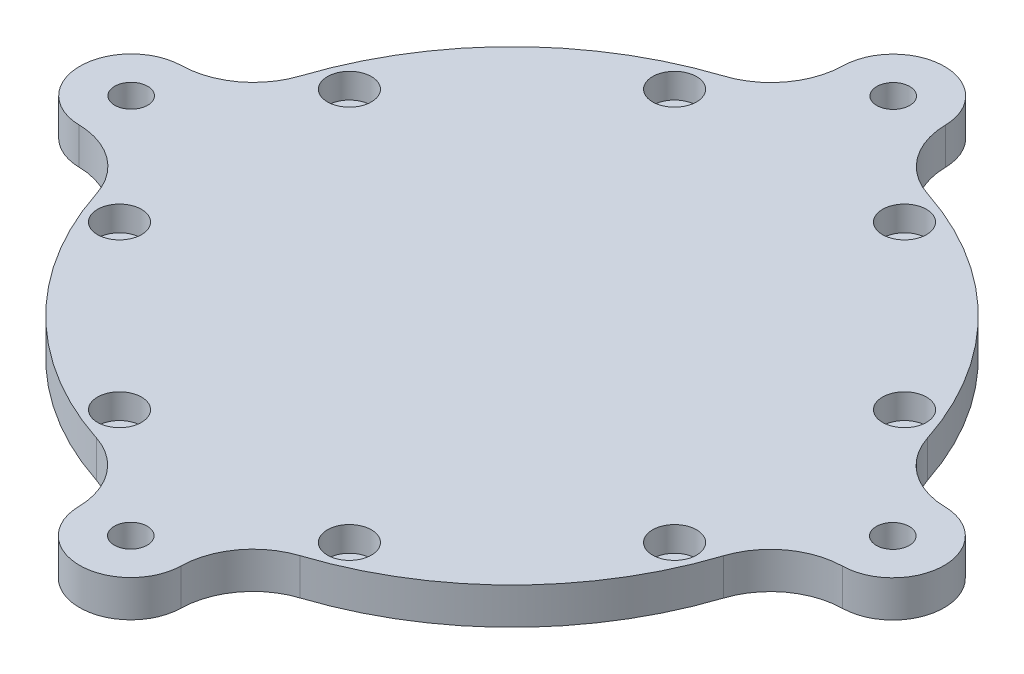
from build123d import *

# Parameters (mm, degrees)
SKETCH1_R                                           = 45
SKETCH1_R_2                                         = 1.5
BOSS_EXTRUDE2_DEPTH                                 = 5
SKETCH9_R                                           = 3.937
BOSS_EXTRUDE7_DEPTH                                 = 4
BOSS_EXTRUDE8_DEPTH                                 = 5
FILLET1_R                                           = 10
SKETCH17_R                                          = 8.317724374
BOSS_EXTRUDE9_DEPTH                                 = 10
CIRPATTERN1_COUNT                                   = 4
FILLET1_OF_CIRPATTERN1_R                            = 10
CUT_EXTRUDE10_DEPTH                                 = 80.287191874
CUT_EXTRUDE10_DEPTH_BACK                            = 80.287191874
SKETCH18_W                                          = 16.635448748
SKETCH18_H                                          = 10
SKETCH18_W_2                                        = 61.874
SKETCH18_H_2                                        = 4
M3_TAPPED_HOLE1_D                                   = 2.5
M3_TAPPED_HOLE1_DEPTH                               = 3.248924226
M3_TAPPED_HOLE1_TIP                                 = 0.751075774
BODY_MOVE_COPY1_OUTLINE_R                           = 2.25
BODY_MOVE_COPY1_OUTLINE_R_2                         = 1.5
BODY_MOVE_COPY1_OUTLINE_R_3                         = 1.25
BODY_MOVE_COPY1_DEPTH                               = 5
BODY_MOVE_COPY1_6_OUTLINE_R                         = 1.5
BODY_MOVE_COPY1_6_OUTLINE_R_2                       = 2.25
BODY_MOVE_COPY1_6_DEPTH                             = 5
BODY_MOVE_COPY1_7_OUTLINE_R                         = 1.25
BODY_MOVE_COPY1_7_DEPTH                             = 0.5281
CBORE_FOR_M3_HEX_SOCKET_HEAD_CAP_SCREW6_D           = 3.4
CBORE_FOR_M3_HEX_SOCKET_HEAD_CAP_SCREW6_CBORE_D     = 6
CBORE_FOR_M3_HEX_SOCKET_HEAD_CAP_SCREW6_CBORE_DEPTH = 3.4


# Read off the part's stored shape, not the designer's step: Body-Move/Copy1
with BuildPart() as part:
    # Sketch1 → Boss-Extrude2 (new body)
    with BuildSketch(Plane(origin=(0, 0, 0), x_dir=(1, 0, 0), z_dir=(0, 1, 0))):
        with Locations(Location((0, 0, 0), (0, 0, 270))):
            Circle(SKETCH1_R)
        with Locations(Location((0, 41, 0), (0, 0, 270))):
            Circle(SKETCH1_R_2, mode=Mode.SUBTRACT)
        with Locations(Location((28.991378029, 28.991378029, 0), (0, 0, 270))):
            Circle(SKETCH1_R_2, mode=Mode.SUBTRACT)
        with Locations(Location((41, 0, 0), (0, 0, 270))):
            Circle(SKETCH1_R_2, mode=Mode.SUBTRACT)
        with Locations(Location((28.991378029, -28.991378029, 0), (0, 0, 270))):
            Circle(SKETCH1_R_2, mode=Mode.SUBTRACT)
        with Locations(Location((0, -41, 0), (0, 0, 270))):
            Circle(SKETCH1_R_2, mode=Mode.SUBTRACT)
        with Locations(Location((-28.991378029, -28.991378029, 0), (0, 0, 270))):
            Circle(SKETCH1_R_2, mode=Mode.SUBTRACT)
        with Locations(Location((-41, 0, 0), (0, 0, 270))):
            Circle(SKETCH1_R_2, mode=Mode.SUBTRACT)
        with Locations(Location((-28.991378029, 28.991378029, 0), (0, 0, 270))):
            Circle(SKETCH1_R_2, mode=Mode.SUBTRACT)
    extrude(amount=BOSS_EXTRUDE2_DEPTH)

    # Sketch9 → Boss-Extrude7 (add)
    with BuildSketch(Plane.XZ):
        with Locations(Location((27, 0, 0), (0, 0, 90))):
            Circle(SKETCH9_R)
        with Locations(Location((0, -27, 0), (0, 0, 90))):
            Circle(SKETCH9_R)
        with Locations(Location((-27, 0, 0), (0, 0, 90))):
            Circle(SKETCH9_R)
        with Locations(Location((0, 27, 0), (0, 0, 90))):
            Circle(SKETCH9_R)
    extrude(amount=BOSS_EXTRUDE7_DEPTH)

    # Sketch16 → Boss-Extrude8 (add)
    with BuildSketch(Plane.XZ):
        with BuildLine():
            ThreePointArc((45.376634658, -26.343140039), (41.586295626, -22.556734731), (41.583514038, -17.199167429))
            ThreePointArc((41.583514038, -17.199167429), (40.114970744, -20.390907832), (38.401897955, -23.458351039))
            Line((38.401897955, -23.458351039), (45.376634658, -26.343140039))
        make_face()
        with BuildLine():
            Line((50.727486729, -13.406046775), (43.752750026, -10.521257775))
            ThreePointArc((43.752750026, -10.521257775), (42.798576033, -13.902585715), (41.583514038, -17.199167429))
            ThreePointArc((41.583514038, -17.199167429), (45.36991937, -13.408828339), (50.727486729, -13.406046775))
        make_face()
        with BuildLine():
            Line((45.972884991, -19.014635038), (41.583514062, -17.199167371))
            ThreePointArc((41.583514062, -17.199167371), (41.586295614, -22.556734702), (45.376634658, -26.343140039))
            Line((45.376634658, -26.343140039), (47.192102325, -21.95376911))
            ThreePointArc((47.192102325, -21.95376911), (45.973779061, -20.736710252), (45.972884991, -19.014635038))
        make_face()
        with BuildLine():
            ThreePointArc((50.727486729, -13.406046775), (45.369919398, -13.408828327), (41.583514062, -17.199167371))
            Line((41.583514062, -17.199167371), (45.972884991, -19.014635038))
            ThreePointArc((45.972884991, -19.014635038), (47.189943849, -17.796311774), (48.912019062, -17.795417704))
            Line((48.912019062, -17.795417704), (50.727486729, -13.406046775))
        make_face()
        with BuildLine():
            ThreePointArc((55.052060694, -19.874593407), (53.871338237, -15.984091013), (50.727486729, -13.406046775))
            Line((50.727486729, -13.406046775), (48.912019062, -17.795417704))
            ThreePointArc((48.912019062, -17.795417704), (49.922542761, -18.62407478), (50.302060694, -19.874593407))
            ThreePointArc((50.302060694, -19.874593407), (49.30257932, -21.745075474), (47.192102325, -21.95376911))
            Line((47.192102325, -21.95376911), (45.376634658, -26.343140039))
            ThreePointArc((45.376634658, -26.343140039), (51.942563088, -25.69387095), (55.052060694, -19.874593407))
        make_face()
    boss_extrude8 = extrude(amount=-BOSS_EXTRUDE8_DEPTH)

    # Fillet1
    fillet1_edges = [part.edges().sort_by_distance(p)[0] for p in [
        (43.752750026, 2.5, -10.521257775),
        (38.401897955, 2.5, -23.458351039),
    ]]
    fillet(fillet1_edges, radius=FILLET1_R)

    # Sketch17 → Boss-Extrude9 (add)
    with BuildSketch(Plane(origin=(0, 5, 0), x_dir=(1, 0, 0), z_dir=(0, 1, 0))):
        with Locations(Location((0, 0, 0), (0, 0, 270))):
            Circle(SKETCH17_R)
    extrude(amount=BOSS_EXTRUDE9_DEPTH)

    # CirPattern1: Boss-Extrude8 ×4 about axis
    cirpattern1_axis = Axis((0, 0, 0), (0, 1, 0))
    for i in range(1, CIRPATTERN1_COUNT):
        add(boss_extrude8.rotate(cirpattern1_axis, i * 360 / CIRPATTERN1_COUNT))

    # Fillet1 of CirPattern1
    fillet1_of_cirpattern1_edges = [part.edges().sort_by_distance(p)[0] for p in [
        (-10.521257775, 2.5, -43.752750026),
        (-23.458351039, 2.5, -38.401897955),
        (-43.752750026, 2.5, 10.521257775),
        (-38.401897955, 2.5, 23.458351039),
        (10.521257775, 2.5, 43.752750026),
        (23.458351039, 2.5, 38.401897955),
    ]]
    fillet(fillet1_of_cirpattern1_edges, radius=FILLET1_OF_CIRPATTERN1_R)

    # Sketch18 → Cut-Extrude10 (cut, two sides: drawn at the far end of the back side and taken through both)
    with BuildSketch(Plane.XY.offset(-CUT_EXTRUDE10_DEPTH_BACK)):
        with Locations((0, 10)):
            Rectangle(SKETCH18_W, SKETCH18_H)
        with Locations((0, -2)):
            Rectangle(SKETCH18_W_2, SKETCH18_H_2)
    extrude(amount=CUT_EXTRUDE10_DEPTH + CUT_EXTRUDE10_DEPTH_BACK, mode=Mode.SUBTRACT)

    # M3 Tapped Hole1
    with Locations(Plane(origin=(0, 0, 0), x_dir=(-1, 0, 0), z_dir=(0, -1, 0))):
        with Locations((7.644074387, 18.481561805), (18.481561805, -7.644074387), (-7.644074387, -18.481561805), (-18.481561805, 7.644074387)):
            Hole(M3_TAPPED_HOLE1_D / 2, depth=M3_TAPPED_HOLE1_DEPTH)
            with Locations((0, 0, -(M3_TAPPED_HOLE1_DEPTH + M3_TAPPED_HOLE1_TIP / 2))):  # 118° drill point
                Cone(0, M3_TAPPED_HOLE1_D / 2, M3_TAPPED_HOLE1_TIP, mode=Mode.SUBTRACT)

    # Body-Move/Copy1 outline → Body-Move/Copy1 (add)
    # profile 1 of 16: a face of its own
    with BuildSketch(Plane(origin=(0, 0, 0), x_dir=(1, 0, 0), z_dir=(0, 1, 0))):
        with BuildLine():
            ThreePointArc((7.025915617, 52.12305613), (0.030631725, 58.999992048), (-6.971789154, 52.130323484))
            ThreePointArc((-6.971789154, 52.130323484), (-7.560114348, 48.93228132), (-9.143409124, 46.092073957))
            ThreePointArc((-9.143409124, 46.092073957), (-6.4153899, 45.062258298), (-3.50626939, 44.863192875))
            ThreePointArc((-3.50626939, 44.863192875), (5.313477338, 44.685198428), (13.929030112, 42.789976866))
            ThreePointArc((13.929030112, 42.789976866), (8.984565659, 46.352303293), (7.025915617, 52.12305613))
        make_face()
        with Locations((0.026997453, 51.999992992)):
            Circle(BODY_MOVE_COPY1_OUTLINE_R, mode=Mode.SUBTRACT)
    # profile 2 of 16: a face of its own
    with BuildSketch(Plane(origin=(0, 0, 0), x_dir=(1, 0, 0), z_dir=(0, 1, 0))):
        with BuildLine():
            ThreePointArc((-44.863192875, -3.50626939), (-44.685198428, 5.313477338), (-42.789976866, 13.929030112))
            ThreePointArc((-42.789976866, 13.929030112), (-46.352303293, 8.984565659), (-52.12305613, 7.025915617))
            ThreePointArc((-52.12305613, 7.025915617), (-58.999992048, 0.030631725), (-52.130323484, -6.971789154))
            ThreePointArc((-52.130323484, -6.971789154), (-48.93228132, -7.560114348), (-46.092073957, -9.143409124))
            ThreePointArc((-46.092073957, -9.143409124), (-45.062258298, -6.4153899), (-44.863192875, -3.50626939))
        make_face()
        with Locations((-51.999992992, 0.026997453)):
            Circle(BODY_MOVE_COPY1_OUTLINE_R, mode=Mode.SUBTRACT)
    # profile 3 of 16: a face of its own
    with BuildSketch(Plane(origin=(0, 0, 0), x_dir=(1, 0, 0), z_dir=(0, 1, 0))):
        with BuildLine():
            ThreePointArc((52.130323484, 6.971789154), (48.93228132, 7.560114348), (46.092073957, 9.143409124))
            ThreePointArc((46.092073957, 9.143409124), (45.062258298, 6.4153899), (44.863192875, 3.50626939))
            ThreePointArc((44.863192875, 3.50626939), (44.685198428, -5.313477338), (42.789976866, -13.929030112))
            ThreePointArc((42.789976866, -13.929030112), (46.352303293, -8.984565659), (52.12305613, -7.025915617))
            ThreePointArc((52.12305613, -7.025915617), (58.999992048, -0.030631725), (52.130323484, 6.971789154))
        make_face()
        with Locations((51.999992992, -0.026997453)):
            Circle(BODY_MOVE_COPY1_OUTLINE_R, mode=Mode.SUBTRACT)
    # profile 4 of 16: a face of its own
    with BuildSketch(Plane(origin=(0, 0, 0), x_dir=(1, 0, 0), z_dir=(0, 1, 0))):
        with BuildLine():
            ThreePointArc((3.50626939, -44.863192875), (-5.313477338, -44.685198428), (-13.929030112, -42.789976866))
            ThreePointArc((-13.929030112, -42.789976866), (-8.984565659, -46.352303293), (-7.025915617, -52.12305613))
            ThreePointArc((-7.025915617, -52.12305613), (-0.030631725, -58.999992048), (6.971789154, -52.130323484))
            ThreePointArc((6.971789154, -52.130323484), (7.560114348, -48.93228132), (9.143409124, -46.092073957))
            ThreePointArc((9.143409124, -46.092073957), (6.4153899, -45.062258298), (3.50626939, -44.863192875))
        make_face()
        with Locations((-0.026997453, -51.999992992)):
            Circle(BODY_MOVE_COPY1_OUTLINE_R, mode=Mode.SUBTRACT)
    # profile 5 of 16: a face of its own
    with BuildSketch(Plane(origin=(0, 0, 0), x_dir=(1, 0, 0), z_dir=(0, 1, 0))):
        with Locations((0, 41)):
            Circle(BODY_MOVE_COPY1_OUTLINE_R_2)
    # profile 6 of 16: a face of its own
    with BuildSketch(Plane(origin=(0, 0, 0), x_dir=(1, 0, 0), z_dir=(0, 1, 0))):
        with Locations((28.991378029, 28.991378029)):
            Circle(BODY_MOVE_COPY1_OUTLINE_R_2)
    # profile 7 of 16: a face of its own
    with BuildSketch(Plane(origin=(0, 0, 0), x_dir=(1, 0, 0), z_dir=(0, 1, 0))):
        with Locations((41, 0)):
            Circle(BODY_MOVE_COPY1_OUTLINE_R_2)
    # profile 8 of 16: a face of its own
    with BuildSketch(Plane(origin=(0, 0, 0), x_dir=(1, 0, 0), z_dir=(0, 1, 0))):
        with Locations((28.991378029, -28.991378029)):
            Circle(BODY_MOVE_COPY1_OUTLINE_R_2)
    # profile 9 of 16: a face of its own
    with BuildSketch(Plane(origin=(0, 0, 0), x_dir=(1, 0, 0), z_dir=(0, 1, 0))):
        with Locations((0, -41)):
            Circle(BODY_MOVE_COPY1_OUTLINE_R_2)
    # profile 10 of 16: a face of its own
    with BuildSketch(Plane(origin=(0, 0, 0), x_dir=(1, 0, 0), z_dir=(0, 1, 0))):
        with Locations((-28.991378029, -28.991378029)):
            Circle(BODY_MOVE_COPY1_OUTLINE_R_2)
    # profile 11 of 16: a face of its own
    with BuildSketch(Plane(origin=(0, 0, 0), x_dir=(1, 0, 0), z_dir=(0, 1, 0))):
        with Locations((-41, 0)):
            Circle(BODY_MOVE_COPY1_OUTLINE_R_2)
    # profile 12 of 16: a face of its own
    with BuildSketch(Plane(origin=(0, 0, 0), x_dir=(1, 0, 0), z_dir=(0, 1, 0))):
        with Locations((-28.991378029, 28.991378029)):
            Circle(BODY_MOVE_COPY1_OUTLINE_R_2)
    # profile 13 of 16: a face of its own
    with BuildSketch(Plane(origin=(0, 0, 0), x_dir=(1, 0, 0), z_dir=(0, 1, 0))):
        with Locations((18.481561805, 7.644074387)):
            Circle(BODY_MOVE_COPY1_OUTLINE_R_3)
    # profile 14 of 16: a face of its own
    with BuildSketch(Plane(origin=(0, 0, 0), x_dir=(1, 0, 0), z_dir=(0, 1, 0))):
        with Locations((7.644074387, -18.481561805)):
            Circle(BODY_MOVE_COPY1_OUTLINE_R_3)
    # profile 15 of 16: a face of its own
    with BuildSketch(Plane(origin=(0, 0, 0), x_dir=(1, 0, 0), z_dir=(0, 1, 0))):
        with Locations((-18.481561805, -7.644074387)):
            Circle(BODY_MOVE_COPY1_OUTLINE_R_3)
    # profile 16 of 16: a face of its own
    with BuildSketch(Plane(origin=(0, 0, 0), x_dir=(1, 0, 0), z_dir=(0, 1, 0))):
        with Locations((-7.644074387, 18.481561805)):
            Circle(BODY_MOVE_COPY1_OUTLINE_R_3)
    extrude(amount=BODY_MOVE_COPY1_DEPTH)

    # Body-Move_Copy1 2 outline → Body-Move_Copy1 2 (revolve)
    with BuildSketch(Plane(origin=(18.481561805, 0, -7.644074387), x_dir=(1, 0, 0), z_dir=(0, 0, 1))):
        Polygon((1.25, 3.248924226), (0, 4), (0, 0), (1.25, 0), align=None)
    revolve(axis=Axis((18.481561805, 0, -7.644074387), (0, 1, 0)))

    # Body-Move_Copy1 3 outline → Body-Move_Copy1 3 (revolve)
    with BuildSketch(Plane(origin=(7.644074387, 0, 18.481561805), x_dir=(1, 0, 0), z_dir=(0, 0, 1))):
        Polygon((1.25, 3.248924226), (0, 4), (0, 0), (1.25, 0), align=None)
    revolve(axis=Axis((7.644074387, 0, 18.481561805), (0, 1, 0)))

    # Body-Move_Copy1 4 outline → Body-Move_Copy1 4 (revolve)
    with BuildSketch(Plane(origin=(-18.481561805, 0, 7.644074387), x_dir=(1, 0, 0), z_dir=(0, 0, 1))):
        Polygon((1.25, 3.248924226), (0, 4), (0, 0), (1.25, 0), align=None)
    revolve(axis=Axis((-18.481561805, 0, 7.644074387), (0, 1, 0)))

    # Body-Move_Copy1 5 outline → Body-Move_Copy1 5 (revolve)
    with BuildSketch(Plane(origin=(-7.644074387, 0, -18.481561805), x_dir=(1, 0, 0), z_dir=(0, 0, 1))):
        Polygon((1.25, 3.248924226), (0, 4), (0, 0), (1.25, 0), align=None)
    revolve(axis=Axis((-7.644074387, 0, -18.481561805), (0, 1, 0)))

    # Body-Move_Copy1 6 outline → Body-Move_Copy1 6 (cut)
    # profile 1 of 12: a face of its own
    with BuildSketch(Plane(origin=(0, 0, 0), x_dir=(1, 0, 0), z_dir=(0, 1, 0))):
        with Locations((-37.879060833, 15.690020727)):
            Circle(BODY_MOVE_COPY1_6_OUTLINE_R)
    # profile 2 of 12: a face of its own
    with BuildSketch(Plane(origin=(0, 0, 0), x_dir=(1, 0, 0), z_dir=(0, 1, 0))):
        with Locations((-15.690020727, 37.879060833)):
            Circle(BODY_MOVE_COPY1_6_OUTLINE_R)
    # profile 3 of 12: a face of its own
    with BuildSketch(Plane(origin=(0, 0, 0), x_dir=(1, 0, 0), z_dir=(0, 1, 0))):
        with Locations((15.690020727, 37.879060833)):
            Circle(BODY_MOVE_COPY1_6_OUTLINE_R)
    # profile 4 of 12: a face of its own
    with BuildSketch(Plane(origin=(0, 0, 0), x_dir=(1, 0, 0), z_dir=(0, 1, 0))):
        with Locations((37.879060833, 15.690020727)):
            Circle(BODY_MOVE_COPY1_6_OUTLINE_R)
    # profile 5 of 12: a face of its own
    with BuildSketch(Plane(origin=(0, 0, 0), x_dir=(1, 0, 0), z_dir=(0, 1, 0))):
        with Locations((37.879060833, -15.690020727)):
            Circle(BODY_MOVE_COPY1_6_OUTLINE_R)
    # profile 6 of 12: a face of its own
    with BuildSketch(Plane(origin=(0, 0, 0), x_dir=(1, 0, 0), z_dir=(0, 1, 0))):
        with Locations((15.690020727, -37.879060833)):
            Circle(BODY_MOVE_COPY1_6_OUTLINE_R)
    # profile 7 of 12: a face of its own
    with BuildSketch(Plane(origin=(0, 0, 0), x_dir=(1, 0, 0), z_dir=(0, 1, 0))):
        with Locations((-15.690020727, -37.879060833)):
            Circle(BODY_MOVE_COPY1_6_OUTLINE_R)
    # profile 8 of 12: a face of its own
    with BuildSketch(Plane(origin=(0, 0, 0), x_dir=(1, 0, 0), z_dir=(0, 1, 0))):
        with Locations((-37.879060833, -15.690020727)):
            Circle(BODY_MOVE_COPY1_6_OUTLINE_R)
    # profile 9 of 12: a face of its own
    with BuildSketch(Plane(origin=(0, 0, 0), x_dir=(1, 0, 0), z_dir=(0, 1, 0))):
        with BuildLine():
            ThreePointArc((-13.884591055, 42.804417193), (-11.271747657, 44.098889502), (-9.143409124, 46.092073957))
            ThreePointArc((-9.143409124, 46.092073957), (-11.69098616, 48.112829129), (-13.45553039, 50.844126234))
            ThreePointArc((-13.45553039, 50.844126234), (-22.550019443, 54.520607326), (-26.390504425, 45.494150687))
            ThreePointArc((-26.390504425, 45.494150687), (-25.998004135, 39.412716496), (-29.208230785, 34.232721984))
            ThreePointArc((-29.208230785, 34.232721984), (-21.968530065, 39.273192979), (-13.884591055, 42.804417193))
        make_face()
        with Locations((-19.874593407, 48.052060694)):
            Circle(BODY_MOVE_COPY1_6_OUTLINE_R_2, mode=Mode.SUBTRACT)
    # profile 10 of 12: a face of its own
    with BuildSketch(Plane(origin=(0, 0, 0), x_dir=(1, 0, 0), z_dir=(0, 1, 0))):
        with BuildLine():
            ThreePointArc((45.494150687, 26.390504425), (39.412716496, 25.998004135), (34.232721984, 29.208230785))
            ThreePointArc((34.232721984, 29.208230785), (39.273192979, 21.968530065), (42.804417193, 13.884591055))
            ThreePointArc((42.804417193, 13.884591055), (44.098889502, 11.271747657), (46.092073957, 9.143409124))
            ThreePointArc((46.092073957, 9.143409124), (48.112829129, 11.69098616), (50.844126234, 13.45553039))
            ThreePointArc((50.844126234, 13.45553039), (54.520607326, 22.550019443), (45.494150687, 26.390504425))
        make_face()
        with Locations((48.052060694, 19.874593407)):
            Circle(BODY_MOVE_COPY1_6_OUTLINE_R_2, mode=Mode.SUBTRACT)
    # profile 11 of 12: a face of its own
    with BuildSketch(Plane(origin=(0, 0, 0), x_dir=(1, 0, 0), z_dir=(0, 1, 0))):
        with BuildLine():
            ThreePointArc((-42.804417193, -13.884591055), (-44.098889502, -11.271747657), (-46.092073957, -9.143409124))
            ThreePointArc((-46.092073957, -9.143409124), (-48.112829129, -11.69098616), (-50.844126234, -13.45553039))
            ThreePointArc((-50.844126234, -13.45553039), (-54.520607326, -22.550019443), (-45.494150687, -26.390504425))
            ThreePointArc((-45.494150687, -26.390504425), (-39.412716496, -25.998004135), (-34.232721984, -29.208230785))
            ThreePointArc((-34.232721984, -29.208230785), (-39.273192979, -21.968530065), (-42.804417193, -13.884591055))
        make_face()
        with Locations((-48.052060694, -19.874593407)):
            Circle(BODY_MOVE_COPY1_6_OUTLINE_R_2, mode=Mode.SUBTRACT)
    # profile 12 of 12: a face of its own
    with BuildSketch(Plane(origin=(0, 0, 0), x_dir=(1, 0, 0), z_dir=(0, 1, 0))):
        with BuildLine():
            ThreePointArc((26.390504425, -45.494150687), (25.998004135, -39.412716496), (29.208230785, -34.232721984))
            ThreePointArc((29.208230785, -34.232721984), (21.968530065, -39.273192979), (13.884591055, -42.804417193))
            ThreePointArc((13.884591055, -42.804417193), (11.271747657, -44.098889502), (9.143409124, -46.092073957))
            ThreePointArc((9.143409124, -46.092073957), (11.69098616, -48.112829129), (13.45553039, -50.844126234))
            ThreePointArc((13.45553039, -50.844126234), (22.550019443, -54.520607326), (26.390504425, -45.494150687))
        make_face()
        with Locations((19.874593407, -48.052060694)):
            Circle(BODY_MOVE_COPY1_6_OUTLINE_R_2, mode=Mode.SUBTRACT)
    extrude(amount=BODY_MOVE_COPY1_6_DEPTH, mode=Mode.SUBTRACT)

    # Body-Move_Copy1 7 outline → Body-Move_Copy1 7 (cut)
    with BuildSketch(Plane(origin=(0, 0, 0), x_dir=(1, 0, 0), z_dir=(0, 1, 0))):
        with Locations((0.010383636, 19.999997305)):
            Circle(BODY_MOVE_COPY1_7_OUTLINE_R)
        with Locations((19.999997305, -0.010383636)):
            Circle(BODY_MOVE_COPY1_7_OUTLINE_R)
        with Locations((-0.010383636, -19.999997305)):
            Circle(BODY_MOVE_COPY1_7_OUTLINE_R)
        with Locations((-19.999997305, 0.010383636)):
            Circle(BODY_MOVE_COPY1_7_OUTLINE_R)
    extrude(amount=BODY_MOVE_COPY1_7_DEPTH, mode=Mode.SUBTRACT)

    # Body-Move_Copy1 8 outline → Body-Move_Copy1 8 (revolve, cut)
    with BuildSketch(Plane(origin=(0.010383636, 0, -19.999997305), x_dir=(1, 0, 0), z_dir=(0, 0, 1))):
        Polygon((1.25, 3.248924226), (0, 4), (0, 0), (1.25, 0), align=None)
    revolve(axis=Axis((0.010383636, 0, -19.999997305), (0, 1, 0)), mode=Mode.SUBTRACT)

    # Body-Move_Copy1 9 outline → Body-Move_Copy1 9 (revolve, cut)
    with BuildSketch(Plane(origin=(19.999997305, 0, 0.010383636), x_dir=(1, 0, 0), z_dir=(0, 0, 1))):
        Polygon((1.25, 3.248924226), (0, 4), (0, 0), (1.25, 0), align=None)
    revolve(axis=Axis((19.999997305, 0, 0.010383636), (0, 1, 0)), mode=Mode.SUBTRACT)

    # Body-Move_Copy1 10 outline → Body-Move_Copy1 10 (revolve, cut)
    with BuildSketch(Plane(origin=(-0.010383636, 0, 19.999997305), x_dir=(1, 0, 0), z_dir=(0, 0, 1))):
        Polygon((1.25, 3.248924226), (0, 4), (0, 0), (1.25, 0), align=None)
    revolve(axis=Axis((-0.010383636, 0, 19.999997305), (0, 1, 0)), mode=Mode.SUBTRACT)

    # Body-Move_Copy1 11 outline → Body-Move_Copy1 11 (revolve, cut)
    with BuildSketch(Plane(origin=(-19.999997305, 0, -0.010383636), x_dir=(1, 0, 0), z_dir=(0, 0, 1))):
        Polygon((1.25, 3.248924226), (0, 4), (0, 0), (1.25, 0), align=None)
    revolve(axis=Axis((-19.999997305, 0, -0.010383636), (0, 1, 0)), mode=Mode.SUBTRACT)

    # CBORE for M3 Hex Socket Head Cap Screw6 (through all)
    with Locations(Plane(origin=(0, 5, 0), x_dir=(1, 0, 0), z_dir=(0, 1, 0))):
        with Locations((-37.879060833, -15.690020727), (-37.879060833, 15.690020727), (-15.690020727, 37.879060833), (15.690020727, 37.879060833), (37.879060833, 15.690020727), (37.879060833, -15.690020727), (15.690020727, -37.879060833), (-15.690020727, -37.879060833)):
            CounterBoreHole(CBORE_FOR_M3_HEX_SOCKET_HEAD_CAP_SCREW6_D / 2, CBORE_FOR_M3_HEX_SOCKET_HEAD_CAP_SCREW6_CBORE_D / 2, CBORE_FOR_M3_HEX_SOCKET_HEAD_CAP_SCREW6_CBORE_DEPTH)


solid = part.part
